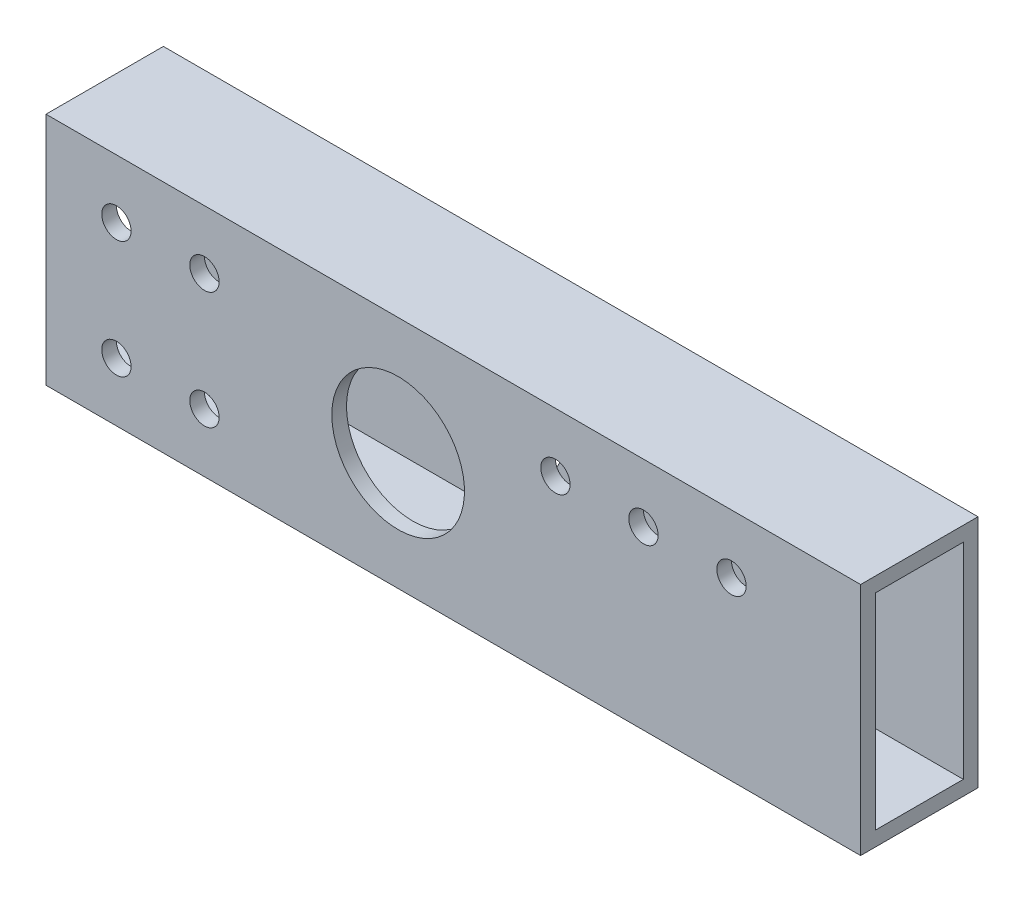
from build123d import *

# Parameters (mm, degrees)
SKETCH1_W           = 176.276
SKETCH1_H           = 25.4
BOSS_EXTRUDE1_DEPTH = 50.8
SKETCH2_OUTSIDE_W   = 64.44
SKETCH2_OUTSIDE_H   = 89.84
SKETCH2_OUTSIDE_W_2 = 25.4
SKETCH2_OUTSIDE_H_2 = 50.8
SKETCH2_OUTSIDE_W_3 = 19.05
SKETCH2_OUTSIDE_H_3 = 44.45
CUT_EXTRUDE1_DEPTH  = 186.199968078
SKETCH3_R           = 14.351
CUT_EXTRUDE2_DEPTH  = 186.199968078
SKETCH4_R           = 3.175
CUT_EXTRUDE3_DEPTH  = 186.199968078
SKETCH5_R           = 3.175
CUT_EXTRUDE4_DEPTH  = 186.199968078


with BuildPart() as part:
    # Sketch1 → Boss-Extrude1 (new body)
    with BuildSketch(Plane(origin=(0, 0, 0), x_dir=(1, 0, 0), z_dir=(0, 1, 0))):
        with Locations((88.138, 12.7)):
            Rectangle(SKETCH1_W, SKETCH1_H)
    extrude(amount=BOSS_EXTRUDE1_DEPTH)

    # Sketch2 outside → Cut-Extrude1 (cut, through all)
    # profile 1 of 2: a face of its own
    with BuildSketch(Plane(origin=(176.276, 0, 0), x_dir=(0, 0, -1), z_dir=(1, 0, 0))):
        with Locations((12.7, 25.4)):
            Rectangle(SKETCH2_OUTSIDE_W, SKETCH2_OUTSIDE_H)
        with Locations((12.7, 25.4)):
            Rectangle(SKETCH2_OUTSIDE_W_2, SKETCH2_OUTSIDE_H_2, mode=Mode.SUBTRACT)
    # profile 2 of 2: a face of its own
    with BuildSketch(Plane(origin=(176.276, 0, 0), x_dir=(0, 0, -1), z_dir=(1, 0, 0))):
        with Locations((12.7, 25.4)):
            Rectangle(SKETCH2_OUTSIDE_W_3, SKETCH2_OUTSIDE_H_3)
    extrude(amount=-CUT_EXTRUDE1_DEPTH, mode=Mode.SUBTRACT)

    # Sketch3 → Cut-Extrude2 (cut, through all)
    with BuildSketch(Plane(origin=(0, 0, -25.4), x_dir=(-1, 0, 0), z_dir=(0, 0, -1))):
        with Locations((-76.2, 25.4)):
            Circle(SKETCH3_R)
    extrude(amount=-CUT_EXTRUDE2_DEPTH, mode=Mode.SUBTRACT)

    # Sketch4 → Cut-Extrude3 (cut, through all)
    with BuildSketch(Plane.XY):
        with Locations((148.336, 38.1)):
            Circle(SKETCH4_R)
        with Locations((129.286, 38.1)):
            Circle(SKETCH4_R)
        with Locations((110.236, 38.1)):
            Circle(SKETCH4_R)
    extrude(amount=-CUT_EXTRUDE3_DEPTH, mode=Mode.SUBTRACT)

    # Sketch5 → Cut-Extrude4 (cut, through all)
    with BuildSketch(Plane.XY):
        with Locations((15.24, 38.1)):
            Circle(SKETCH5_R)
        with Locations((15.24, 12.7)):
            Circle(SKETCH5_R)
        with Locations((34.29, 12.7)):
            Circle(SKETCH5_R)
        with Locations((34.29, 38.1)):
            Circle(SKETCH5_R)
    extrude(amount=-CUT_EXTRUDE4_DEPTH, mode=Mode.SUBTRACT)


solid = part.part
